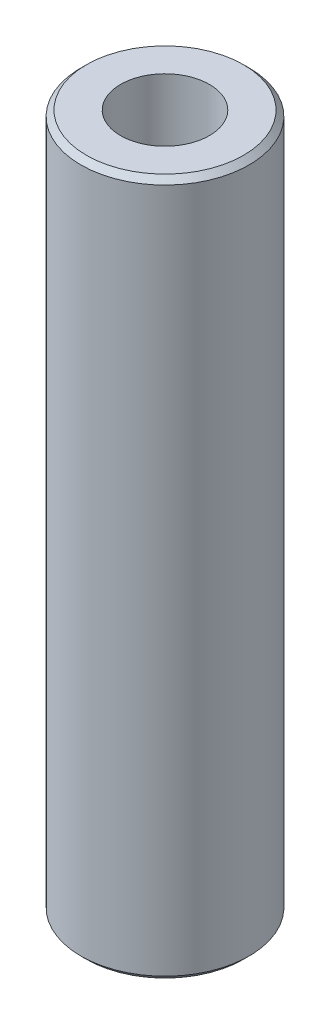
from build123d import *

# Parameters (mm, degrees)
SKETCH1_R           = 22.5
BOSS_EXTRUDE1_DEPTH = 186.289802804
SKETCH2_R           = 11.887612575
CUT_EXTRUDE1_DEPTH  = 189.987805502
CHAMFER1_SIZE       = 1.489178189


with BuildPart() as part:
    # Sketch1 → Boss-Extrude1 (new body)
    with BuildSketch(Plane(origin=(0, 0, 0), x_dir=(1, 0, 0), z_dir=(0, 1, 0))):
        Circle(SKETCH1_R)
    extrude(amount=BOSS_EXTRUDE1_DEPTH)

    # Sketch2 → Cut-Extrude1 (cut, through all)
    with BuildSketch(Plane(origin=(0, 0, 0), x_dir=(1, 0, 0), z_dir=(0, 1, 0))):
        Circle(SKETCH2_R)
    extrude(amount=CUT_EXTRUDE1_DEPTH, mode=Mode.SUBTRACT)

    # Chamfer1
    chamfer1_edges = [part.edges().sort_by_distance(p)[0] for p in [
        (-22.5, 186.289802804, 0),
        (-22.5, 0, 0),
    ]]
    chamfer(chamfer1_edges, length=CHAMFER1_SIZE)


solid = part.part
